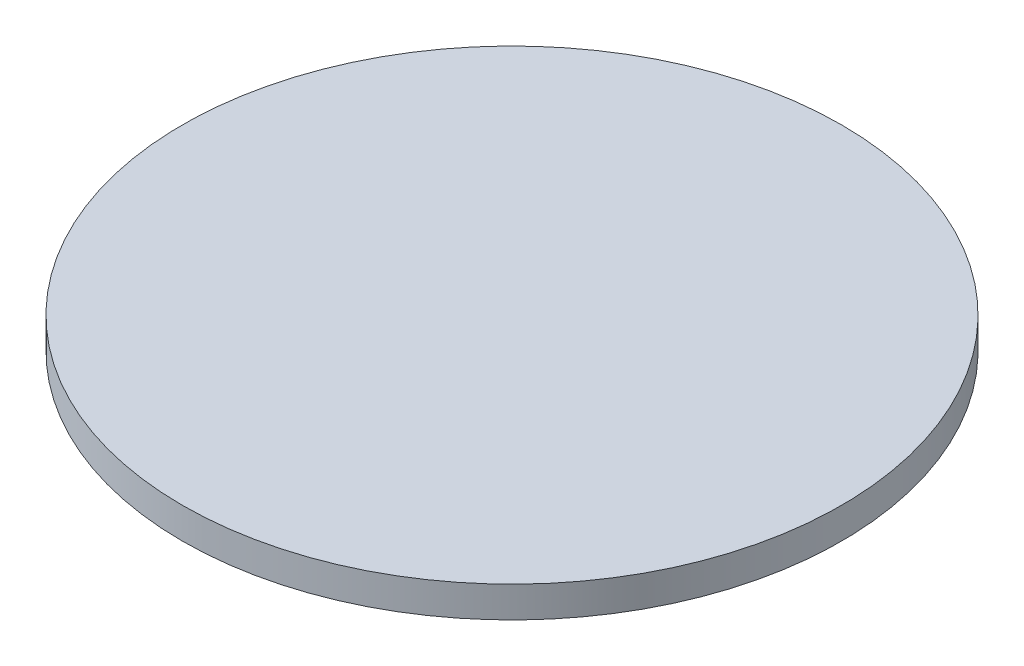
from build123d import *

# Parameters (mm, degrees)
SKETCH_1_R      = 42.5
EXTRUDE_1_DEPTH = 4


with BuildPart() as part:
    # Эскиз1 → Вытянуть1 (new body)
    with BuildSketch(Plane(origin=(0, 0, 0), x_dir=(1, 0, 0), z_dir=(0, 1, 0))):
        Circle(SKETCH_1_R)
    extrude(amount=EXTRUDE_1_DEPTH)


solid = part.part
